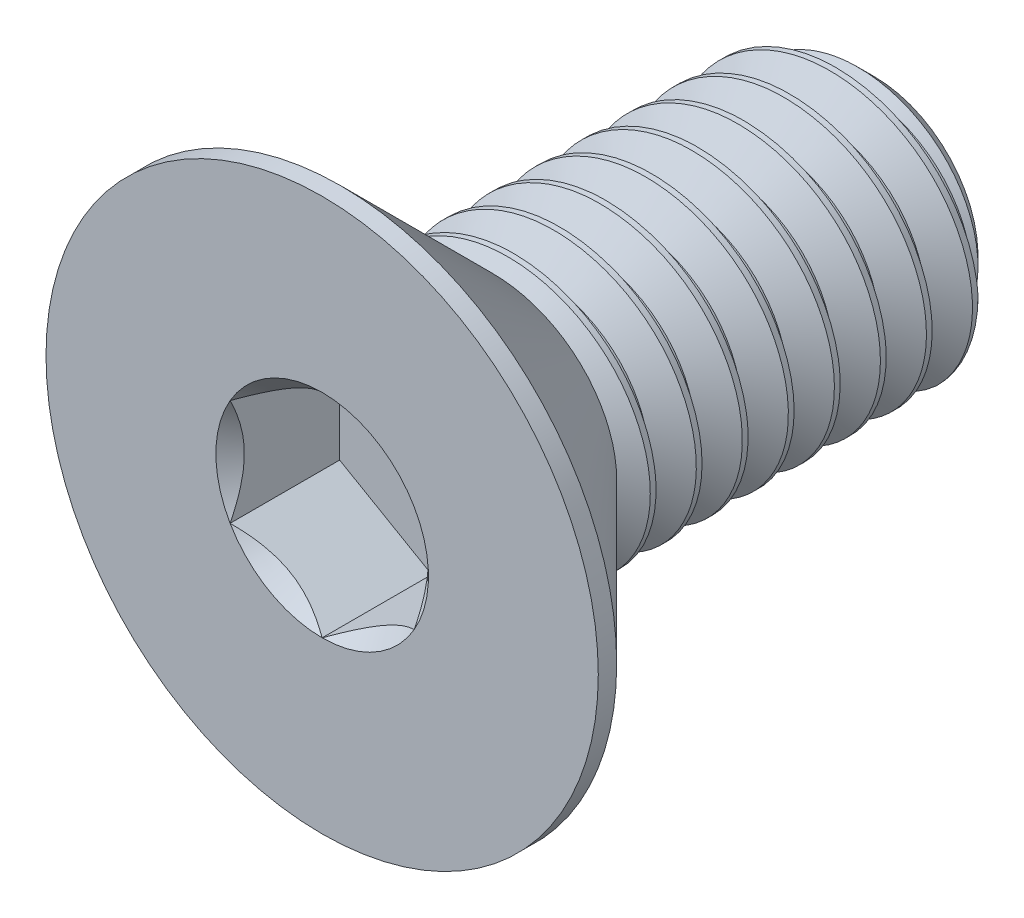
from build123d import *
from build123d.topology import SkipClean

# Parameters (mm, degrees)
SKETCH1_W          = 6
SKETCH1_H          = 1.5
CHAMFER1_SIZE      = 0.375
CUT_SWEEP1_PITCH   = 0.5
CUT_EXTRUDE2_DEPTH = 1.19


with BuildPart() as part:
    # Sketch1 → Revolve1 (revolve)
    with BuildSketch(Plane(origin=(0, 0, 0), x_dir=(0, 0, -1), z_dir=(1, 0, 0))):
        with Locations((3, 0.75)):
            Rectangle(SKETCH1_W, SKETCH1_H)
    revolve(axis=Axis((0, 0, -6), (0, 0, 1)))

    # Chamfer1
    chamfer1_edges = [part.edges().sort_by_distance(p)[0] for p in [
        (0, -1.5, -6),
    ]]
    chamfer(chamfer1_edges, length=CHAMFER1_SIZE)

    # Cut-Sweep1: the profile of Sketch2 profile screwed along a right-hand helix of 12 turns, 6 arcs to a turn; built about Z, then put on its axis
    cut_sweep1_z = Axis((0, 0, 0), (0, 0, 1))
    cut_sweep1_corners = [(1.5003, 0, 0.000173205), (1.5003, 0, -0.437673205), (1.175240474, 0, -0.25), (1.175240474, 0, -0.1875)]
    with BuildLine(mode=Mode.PRIVATE) as cut_sweep1_profile:
        Line(cut_sweep1_corners[0], cut_sweep1_corners[1])
        Line(cut_sweep1_corners[1], cut_sweep1_corners[2])
        Line(cut_sweep1_corners[2], cut_sweep1_corners[3])
        Line(cut_sweep1_corners[3], cut_sweep1_corners[0])
    cut_sweep1_cap = Face(cut_sweep1_profile.wire())
    cut_sweep1_turn_angles = [0, 30, 60, 90, 120, 150, 180, 210, 240, 270, 300, 330, 360]
    cut_sweep1_turn_weights = [1, 0.8660254037844387, 1, 0.8660254037844387, 1, 0.8660254037844387, 1, 0.8660254037844387, 1, 0.8660254037844387, 1, 0.8660254037844387, 1]
    cut_sweep1_turn_rails = [Edge.make_bspline([Vector(p[0], p[1], 0).rotate(cut_sweep1_z, cut_sweep1_turn_angles[k]) / cut_sweep1_turn_weights[k] + Vector(0, 0, p[2] + CUT_SWEEP1_PITCH * cut_sweep1_turn_angles[k] / 360) for k in range(13)], [0, 0, 0, 1, 1, 2, 2, 3, 3, 4, 4, 5, 5, 6, 6, 6], 2, cut_sweep1_turn_weights) for p in cut_sweep1_corners]
    cut_sweep1_turn_sides = [Face.make_surface_from_curves(cut_sweep1_turn_rails[p[0]], cut_sweep1_turn_rails[p[1]]) for p in [(0, 1), (1, 2), (2, 3), (3, 0)]]
    cut_sweep1 = Plane(origin=(0, 0, -6), x_dir=(0, 1, 0), z_dir=(0, 0, 1)) * Solid(Shell([*[p.moved(Location((0, 0, CUT_SWEEP1_PITCH * i))) for i in range(12) for p in cut_sweep1_turn_sides], cut_sweep1_cap, cut_sweep1_cap.rotate(cut_sweep1_z, 4320).moved(Location((0, 0, CUT_SWEEP1_PITCH * 4320 / 360)))]))
    add(cut_sweep1, mode=Mode.SUBTRACT)

    # Sketch7 → Revolve2 (revolve)
    with BuildSketch(Plane(origin=(0, 0, 0), x_dir=(0, 0, -1), z_dir=(1, 0, 0)), mode=Mode.PRIVATE) as revolve2_sk:
        Polygon((0, 3), (0.2, 3), (1.7, 1.5), (1.7, 0), (0, 0), align=None)
    revolve(revolve2_sk.sketch.rotate(Axis((0, 0, 0), (0, 0, -1)), 180), axis=Axis((0, 0, 0), (0, 0, -1)))

    # Boss-Extrude1 cone 1 section (through the dimple's axis) → Boss-Extrude1 (revolve)
    with SkipClean():  # the faces are left unmerged after this step: merging them gives an invalid solid
        with BuildSketch(Plane(origin=(0, 0, -1.7), x_dir=(0, -1, 0), z_dir=(1, 0, 0))):
            Polygon((0, 0), (1.5, 0), (0, 1.5), align=None)
        revolve(axis=Axis((0, 0, -1.7), (0, 0, -1)))

    # Sketch5 → Cut-Extrude2 (cut)
    with SkipClean():  # the faces are left unmerged after this step: merging them gives an invalid solid
        with BuildSketch(Plane.XY):
            Polygon((1, -0.577350269), (1, 0.577350269), (0, 1.154700538), (-1, 0.577350269), (-1, -0.577350269), (0, -1.154700538), align=None)
        extrude(amount=-CUT_EXTRUDE2_DEPTH, mode=Mode.SUBTRACT)

    # Cut-Extrude3 cone 1 section (through the dimple's axis) → Cut-Extrude3 (revolve, cut)
    with SkipClean():  # the faces are left unmerged after this step: merging them gives an invalid solid
        with BuildSketch(Plane(origin=(0, 0, 0), x_dir=(0, -1, 0), z_dir=(1, 0, 0))):
            Polygon((0, 0), (1.154700538, 0), (0, 1.154700538), align=None)
        revolve(axis=Axis((0, 0, 0), (0, 0, -1)), mode=Mode.SUBTRACT)


solid = part.part
